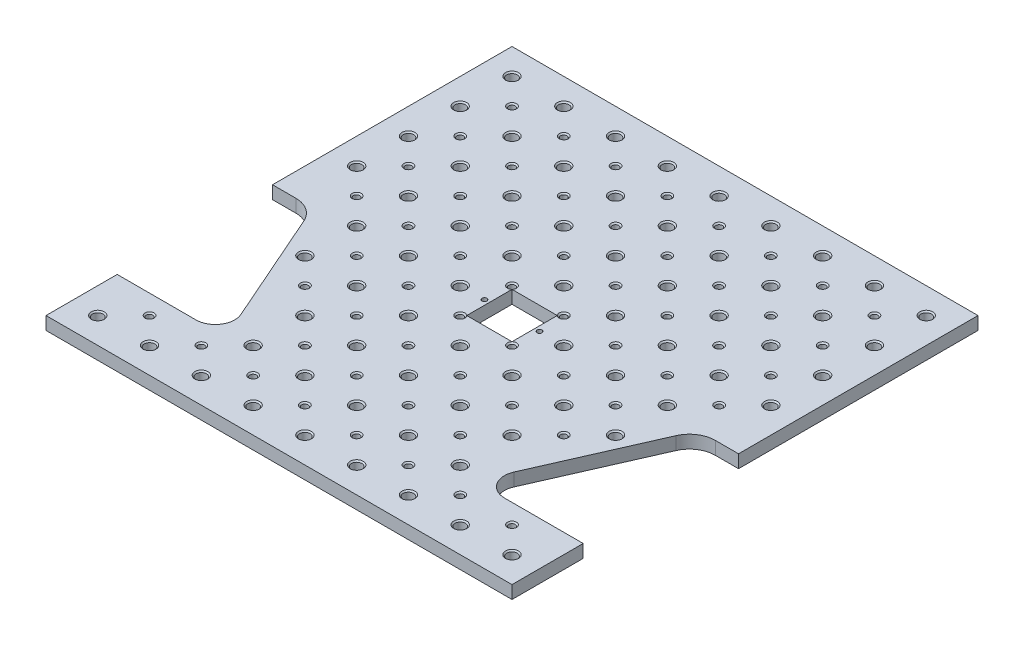
from build123d import *

# Parameters (mm, degrees)
SKETCH1_W                                   = 228.6
SKETCH1_H                                   = 228.6
BOSS_EXTRUDE1_DEPTH                         = 3.175
SKETCH2_W                                   = 22.225
SKETCH2_H                                   = 22.225
CUT_EXTRUDE1_DEPTH                          = 162.769287876
TAPPED_HOLE_FOR_2_56_HELICOIL1_D            = 2.38252
F_10_32_TAPPED_HOLE1_D                      = 4.0386
CUT_EXTRUDE3_DEPTH                          = 162.769287876
FILLET4_R                                   = 12.7
TAPPED_HOLE_FOR_10_32_HELICOIL1_D           = 5.1054
TAPPED_HOLE_FOR_10_32_HELICOIL1_CSINK_D     = 6.3754
TAPPED_HOLE_FOR_10_32_HELICOIL1_CSINK_ANGLE = 90
F_1_8_0_1250_DOWEL_HOLE1_D                  = 3.175
F_1_8_0_1250_DOWEL_HOLE1_CSINK_D            = 4.445
F_1_8_0_1250_DOWEL_HOLE1_CSINK_ANGLE        = 90
THREAD_HOLE_PATTERN_COUNT                   = 9
THREAD_HOLE_PATTERN_PITCH                   = 25.4
THREAD_HOLE_PATTERN_COUNT_DIR2              = 9
THREAD_HOLE_PATTERN_PITCH_DIR2              = 25.4
PIN_HOLE_PATTERN_COUNT                      = 8
PIN_HOLE_PATTERN_PITCH                      = 25.4
PIN_HOLE_PATTERN_COUNT_DIR2                 = 8
PIN_HOLE_PATTERN_PITCH_DIR2                 = 25.4


with BuildPart() as part:
    # Sketch1 → Boss-Extrude1 (new, symmetric)
    with BuildSketch(Plane(origin=(0, 0, 0), x_dir=(1, 0, 0), z_dir=(0, 1, 0))):
        Rectangle(SKETCH1_W, SKETCH1_H)
    extrude(amount=BOSS_EXTRUDE1_DEPTH, both=True)

    # Sketch2 → Cut-Extrude1 (cut, through all)
    with BuildSketch(Plane(origin=(0, 3.175, 0), x_dir=(1, 0, 0), z_dir=(0, 1, 0))):
        Rectangle(SKETCH2_W, SKETCH2_H)
    extrude(amount=-CUT_EXTRUDE1_DEPTH, mode=Mode.SUBTRACT)

    # Tapped Hole for #2-56 Helicoil1 (through all)
    with Locations(Plane(origin=(0, 3.175, 0), x_dir=(1, 0, 0), z_dir=(0, 1, 0))):
        with Locations((-13.5, 0), (13.5, 0)):
            Hole(TAPPED_HOLE_FOR_2_56_HELICOIL1_D / 2)

    # #10-32 Tapped Hole1 (through all)
    with Locations(Plane(origin=(0, 3.175, 0), x_dir=(1, 0, 0), z_dir=(0, 1, 0))):
        with Locations((-101.6, -101.6), (-76.2, 76.2), (76.2, 76.2), (101.6, -101.6)):
            Hole(F_10_32_TAPPED_HOLE1_D / 2)

    # Sketch19 → Cut-Extrude3 (cut, through all)
    with BuildSketch(Plane(origin=(0, 3.175, 0), x_dir=(1, 0, 0), z_dir=(0, 1, 0))):
        with BuildLine():
            Line((-114.3, -3.175), (-114.3, -79.375))
            Line((-114.3, -79.375), (-75.684253216, -79.375))
            ThreePointArc((-75.684253216, -79.375), (-67.707275797, -75.055137487), (-66.965877532, -66.013914699))
            Line((-66.965877532, -66.013914699), (-94.615, -3.175))
            Line((-94.615, -3.175), (-114.3, -3.175))
        make_face()
        with BuildLine():
            Line((75.684253216, -79.375), (114.3, -79.375))
            Line((114.3, -79.375), (114.3, -3.175))
            Line((114.3, -3.175), (94.615, -3.175))
            Line((94.615, -3.175), (66.965877532, -66.013914699))
            ThreePointArc((66.965877532, -66.013914699), (67.707275797, -75.055137487), (75.684253216, -79.375))
        make_face()
    extrude(amount=-CUT_EXTRUDE3_DEPTH, mode=Mode.SUBTRACT)

    # Fillet4
    fillet4_edges = [part.edges().sort_by_distance(p)[0] for p in [
        (94.615, 0, 3.175),
        (-94.615, 0, 3.175),
    ]]
    fillet(fillet4_edges, radius=FILLET4_R)

    # Tapped Hole for #10-32 Helicoil1 (through all)
    with Locations(Plane(origin=(0, 3.175, 0), x_dir=(1, 0, 0), z_dir=(0, 1, 0))):
        with Locations((-101.6, 101.6)):
            tapped_hole_for_10_32_helicoil1 = CounterSinkHole(TAPPED_HOLE_FOR_10_32_HELICOIL1_D / 2, TAPPED_HOLE_FOR_10_32_HELICOIL1_CSINK_D / 2, counter_sink_angle=TAPPED_HOLE_FOR_10_32_HELICOIL1_CSINK_ANGLE)

    # 1/8 (0.1250) Dowel Hole1 (through all)
    with Locations(Plane(origin=(0, 3.175, 0), x_dir=(1, 0, 0), z_dir=(0, 1, 0))):
        with Locations((-88.9, 88.9), (-101.6, 101.6)):
            f_1_8_0_1250_dowel_hole1 = CounterSinkHole(F_1_8_0_1250_DOWEL_HOLE1_D / 2, F_1_8_0_1250_DOWEL_HOLE1_CSINK_D / 2, counter_sink_angle=F_1_8_0_1250_DOWEL_HOLE1_CSINK_ANGLE)

    # Thread Hole Pattern: Tapped Hole for _10-32 Helicoil1 9 × 9, 13 skipped
    with Locations(*[(i * THREAD_HOLE_PATTERN_PITCH, 0, j * THREAD_HOLE_PATTERN_PITCH_DIR2) for i in range(THREAD_HOLE_PATTERN_COUNT) for j in range(THREAD_HOLE_PATTERN_COUNT_DIR2) if (i, j) not in ((0, 0), (0, 4), (0, 5), (0, 6), (0, 7), (1, 6), (1, 7), (4, 4), (7, 6), (7, 7), (8, 4), (8, 5), (8, 6), (8, 7))]):
        add(tapped_hole_for_10_32_helicoil1, mode=Mode.SUBTRACT)

    # Pin Hole Pattern: 1_8 _0.1250_ Dowel Hole1 8 × 8, 8 skipped
    with Locations(*[(i * PIN_HOLE_PATTERN_PITCH, 0, j * PIN_HOLE_PATTERN_PITCH_DIR2) for i in range(PIN_HOLE_PATTERN_COUNT) for j in range(PIN_HOLE_PATTERN_COUNT_DIR2) if (i, j) not in ((0, 0), (0, 4), (0, 5), (0, 6), (1, 6), (6, 6), (7, 4), (7, 5), (7, 6))]):
        add(f_1_8_0_1250_dowel_hole1, mode=Mode.SUBTRACT)


solid = part.part
